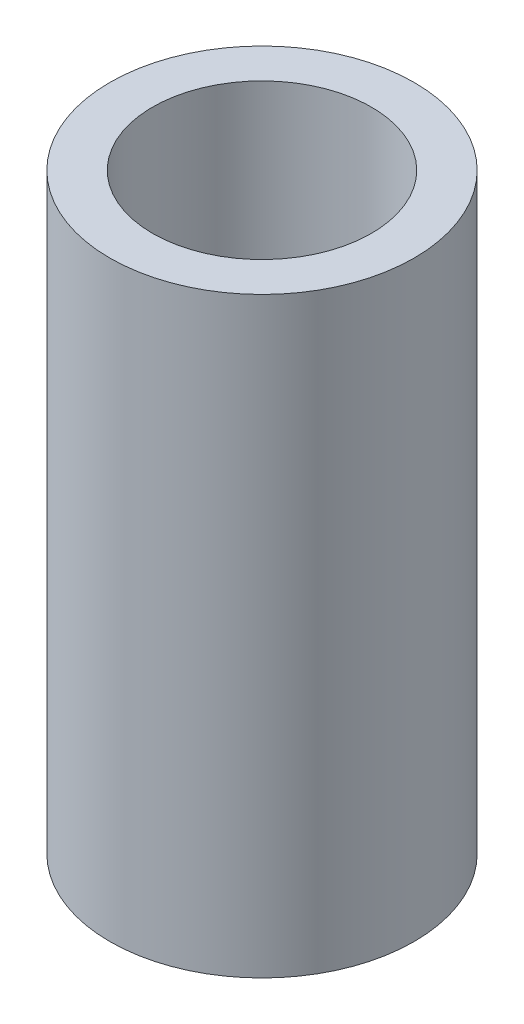
from build123d import *

# Parameters (mm, degrees)
SKETCH1_R           = 22.5
BOSS_EXTRUDE1_DEPTH = 87.540534644
SKETCH2_R           = 16.183882557
CUT_EXTRUDE1_DEPTH  = 94.144217243


with BuildPart() as part:
    # Sketch1 → Boss-Extrude1 (new body)
    with BuildSketch(Plane(origin=(0, 0, 0), x_dir=(1, 0, 0), z_dir=(0, 1, 0))):
        Circle(SKETCH1_R)
    extrude(amount=BOSS_EXTRUDE1_DEPTH)

    # Sketch2 → Cut-Extrude1 (cut, through all)
    with BuildSketch(Plane(origin=(0, 0, 0), x_dir=(1, 0, 0), z_dir=(0, 1, 0))):
        Circle(SKETCH2_R)
    extrude(amount=CUT_EXTRUDE1_DEPTH, mode=Mode.SUBTRACT)


solid = part.part
